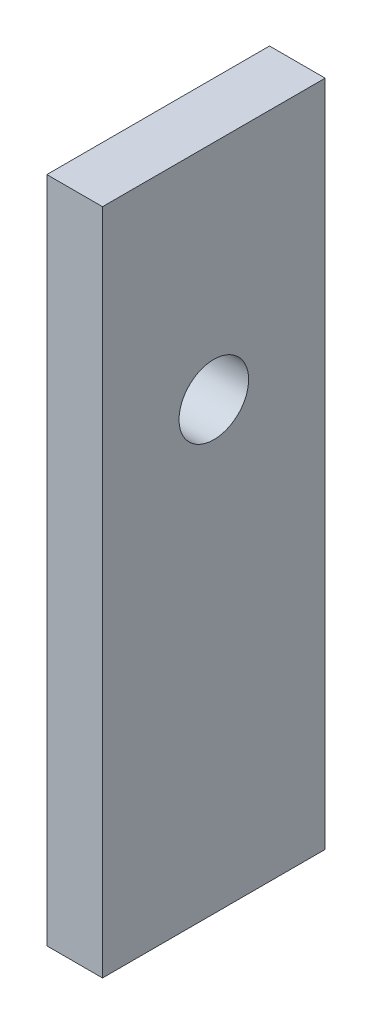
from build123d import *

# Parameters (mm, degrees)
SKETCH1_W               = 25.4
SKETCH1_H               = 76.2
BOSS_EXTRUDE1_DEPTH     = 6.35
CUT_EXTRUDE1_DEPTH      = 41.659838908
CUT_EXTRUDE1_DEPTH_BACK = 41.659838908
SKETCH2_R               = 3.96875


with BuildPart() as part:
    # Sketch1 → Boss-Extrude1 (new body)
    with BuildSketch(Plane(origin=(0, 0, 0), x_dir=(0, 0, -1), z_dir=(1, 0, 0))):
        Rectangle(SKETCH1_W, SKETCH1_H)
    extrude(amount=BOSS_EXTRUDE1_DEPTH)

    # Sketch2 → Cut-Extrude1 (cut, two sides: drawn at the far end of the back side and taken through both)
    with BuildSketch(Plane(origin=(6.35, 0, 0), x_dir=(0, 0, -1), z_dir=(1, 0, 0)).offset(-CUT_EXTRUDE1_DEPTH_BACK)):
        with Locations((0, 12.7)):
            Circle(SKETCH2_R)
    extrude(amount=CUT_EXTRUDE1_DEPTH + CUT_EXTRUDE1_DEPTH_BACK, mode=Mode.SUBTRACT)


solid = part.part
